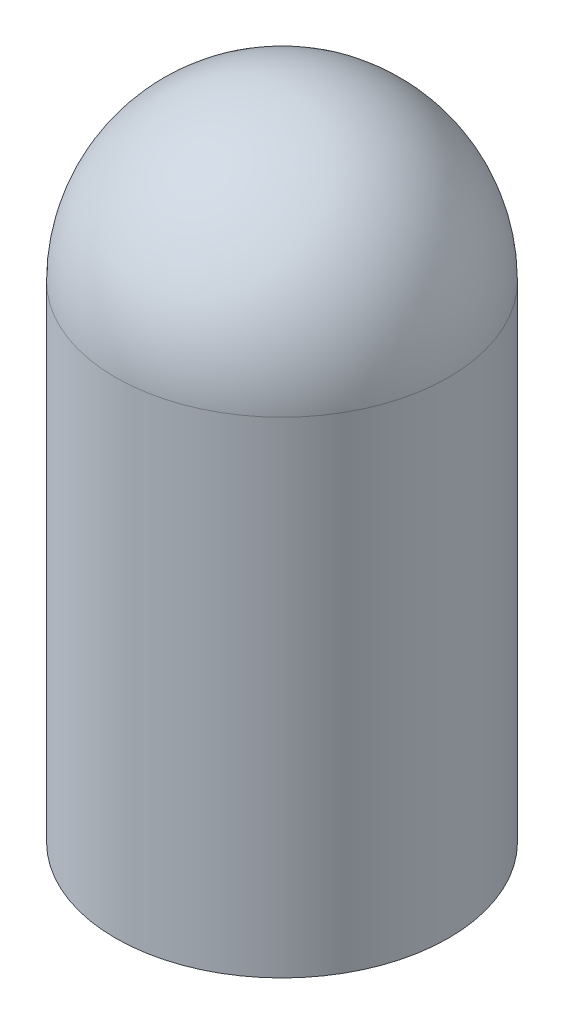
from build123d import *


with BuildPart() as part:
    # Sketch3 → Revolve1 (revolve)
    with BuildSketch(Plane.XY):
        with BuildLine():
            Line((-12, 0), (-12, 35))
            ThreePointArc((-12, 35), (-8.485281374, 43.485281374), (0, 47))
            Line((0, 47), (0, 45.5))
            ThreePointArc((0, 45.5), (-7.424621202, 42.424621202), (-10.5, 35))
            Line((-10.5, 35), (-10.5, 0))
            Line((-10.5, 0), (-12, 0))
        make_face()
    revolve(axis=Axis((0, 0, 0), (0, -1, 0)))


solid = part.part
